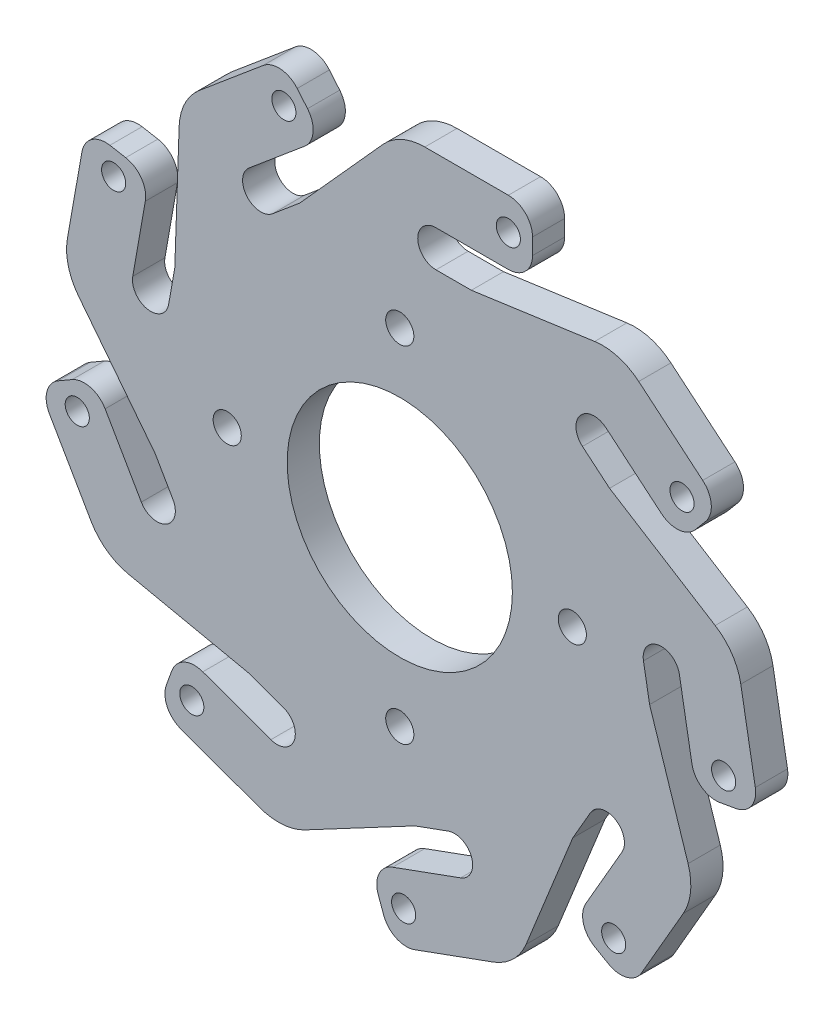
from build123d import *

# Parameters (mm, degrees)
SKETCH1_R          = 14
SKETCH1_R_2        = 1.75
SKETCH1_R_3        = 1.5
BASE_FLANGE1_DEPTH = 4


# Sheet-metal steps are written as plain solids
with BuildPart() as part:
    # Sketch1 → Base-Flange1 (new body)
    with BuildSketch(Plane.XY):
        with BuildLine():
            Line((-12.445814591, 28.677522558), (-2.085412981, 40.183914245))
            ThreePointArc((-2.085412981, 40.183914245), (0.269444296, 41.894818203), (3.116600797, 42.5))
            Line((3.116600797, 42.5), (13.5, 42.5))
            ThreePointArc((13.5, 42.5), (15.621320344, 41.621320344), (16.5, 39.5))
            Line((16.5, 39.5), (16.5, 37.5))
            ThreePointArc((16.5, 37.5), (15.621320344, 35.378679656), (13.5, 34.5))
            Line((13.5, 34.5), (4.5, 34.5))
            ThreePointArc((4.5, 34.5), (2.234136105, 32.234136105), (4.5, 29.96827221))
            Line((4.5, 29.96827221), (8.899509069, 29.96827221))
            Line((8.899509069, 29.96827221), (24.232203159, 32.123141835))
            ThreePointArc((24.232203159, 32.123141835), (27.135876357, 31.920097226), (29.705928134, 30.553576456))
            Line((29.705928134, 30.553576456), (37.660073394, 23.879256102))
            ThreePointArc((37.660073394, 23.879256102), (38.720294659, 21.842590001), (38.029843894, 19.652759943))
            Line((38.029843894, 19.652759943), (36.744268675, 18.120671057))
            ThreePointArc((36.744268675, 18.120671057), (34.707602574, 17.060449792), (32.517772516, 17.750900557))
            Line((32.517772516, 17.750900557), (25.623372528, 23.535989044))
            ThreePointArc((25.623372528, 23.535989044), (22.431150845, 23.256705835), (22.710434054, 20.064484152))
            Line((22.710434054, 20.064484152), (26.080653529, 17.236534234))
            Line((26.080653529, 17.236534234), (39.211302131, 9.031594352))
            ThreePointArc((39.211302131, 9.031594352), (41.305130289, 7.009608003), (42.395521552, 4.310794923))
            Line((42.395521552, 4.310794923), (44.198579902, -5.914857115))
            ThreePointArc((44.198579902, -5.914857115), (43.701612775, -8.156530957), (41.765101175, -9.390224907))
            Line((41.765101175, -9.390224907), (39.795485669, -9.737521262))
            ThreePointArc((39.795485669, -9.737521262), (37.553811827, -9.240554136), (36.320117877, -7.304042536))
            Line((36.320117877, -7.304042536), (34.757284278, 1.559227241))
            ThreePointArc((34.757284278, 1.559227241), (32.132380811, 3.397204436), (30.294403616, 0.772300968))
            Line((30.294403616, 0.772300968), (31.058370348, -3.560369672))
            Line((31.058370348, -3.560369672), (35.84299705, -18.285936503))
            ThreePointArc((35.84299705, -18.285936503), (36.147254703, -21.180754707), (35.247779262, -23.949055464))
            Line((35.247779262, -23.949055464), (30.056079661, -32.941342951))
            ThreePointArc((30.056079661, -32.941342951), (28.234460585, -34.33912043), (25.958003449, -34.039419162))
            Line((25.958003449, -34.039419162), (24.225952642, -33.039419162))
            ThreePointArc((24.225952642, -33.039419162), (22.828175163, -31.217800086), (23.127876431, -28.941342951))
            Line((23.127876431, -28.941342951), (27.627876431, -21.147114317))
            ThreePointArc((27.627876431, -21.147114317), (26.798512683, -18.051886675), (23.703285041, -18.881250422))
            Line((23.703285041, -18.881250422), (21.503530506, -22.69133704))
            Line((21.503530506, -22.69133704), (15.703355299, -37.047274443))
            ThreePointArc((15.703355299, -37.047274443), (14.07567691, -39.460406892), (11.60720932, -41.002876635))
            Line((11.60720932, -41.002876635), (1.850005711, -44.554208318))
            ThreePointArc((1.850005711, -44.554208318), (-0.443909504, -44.454053817), (-1.995132582, -42.761190886))
            Line((-1.995132582, -42.761190886), (-2.679172868, -40.881805644))
            ThreePointArc((-2.679172868, -40.881805644), (-2.579018367, -38.587890429), (-0.886155436, -37.036667352))
            Line((-0.886155436, -37.036667352), (7.571078151, -33.958486062))
            ThreePointArc((7.571078151, -33.958486062), (8.925322639, -31.054299386), (6.021135963, -29.700054898))
            Line((6.021135963, -29.700054898), (1.886949755, -31.20477562))
            Line((1.886949755, -31.20477562), (-11.78406092, -38.473780937))
            ThreePointArc((-11.78406092, -38.473780937), (-14.582066543, -39.276096138), (-17.464502862, -38.870996132))
            Line((-17.464502862, -38.870996132), (-27.221706472, -35.319664448))
            ThreePointArc((-27.221706472, -35.319664448), (-28.914569403, -33.768441371), (-29.014723904, -31.474526156))
            Line((-29.014723904, -31.474526156), (-28.330683618, -29.595140915))
            ThreePointArc((-28.330683618, -29.595140915), (-26.779460541, -27.902277983), (-24.485545325, -27.802123482))
            Line((-24.485545325, -27.802123482), (-16.028311738, -30.880304772))
            ThreePointArc((-16.028311738, -30.880304772), (-13.124125062, -29.526060284), (-14.47836955, -26.621873608))
            Line((-14.47836955, -26.621873608), (-18.612555757, -25.117152886))
            Line((-18.612555757, -25.117152886), (-33.757584069, -21.897977741))
            ThreePointArc((-33.757584069, -21.897977741), (-36.416698999, -20.714063497), (-38.364380059, -18.550944536))
            Line((-38.364380059, -18.550944536), (-43.556079661, -9.558657049))
            ThreePointArc((-43.556079661, -9.558657049), (-43.855780928, -7.282199914), (-42.458003449, -5.460580838))
            Line((-42.458003449, -5.460580838), (-40.725952642, -4.460580838))
            ThreePointArc((-40.725952642, -4.460580838), (-38.449495507, -4.16087957), (-36.627876431, -5.558657049))
            Line((-36.627876431, -5.558657049), (-32.127876431, -13.352885683))
            ThreePointArc((-32.127876431, -13.352885683), (-29.032648788, -14.18224943), (-28.203285041, -11.087021788))
            Line((-28.203285041, -11.087021788), (-30.403039576, -7.27693517))
            Line((-30.403039576, -7.27693517), (-39.935558458, 4.924132608))
            ThreePointArc((-39.935558458, 4.924132608), (-41.211553267, 7.540309666), (-41.313137454, 10.449300179))
            Line((-41.313137454, 10.449300179), (-39.510079105, 20.674952217))
            ThreePointArc((-39.510079105, 20.674952217), (-38.276385155, 22.611463816), (-36.034711312, 23.108430943))
            Line((-36.034711312, 23.108430943), (-34.065095806, 22.761134587))
            ThreePointArc((-34.065095806, 22.761134587), (-32.128584207, 21.527440637), (-31.63161708, 19.285766795))
            Line((-31.63161708, 19.285766795), (-33.194450679, 10.422497018))
            ThreePointArc((-33.194450679, 10.422497018), (-31.356473484, 7.797593551), (-28.731570017, 9.635570746))
            Line((-28.731570017, 9.635570746), (-27.967603284, 13.968241386))
            Line((-27.967603284, 13.968241386), (-27.427241211, 29.442186584))
            ThreePointArc((-27.427241211, 29.442186584), (-26.723063746, 32.266488135), (-24.93101869, 34.560201209))
            Line((-24.93101869, 34.560201209), (-16.97687343, 41.234521563))
            ThreePointArc((-16.97687343, 41.234521563), (-14.787043372, 41.924972328), (-12.750377271, 40.864751063))
            Line((-12.750377271, 40.864751063), (-11.464802052, 39.332662177))
            ThreePointArc((-11.464802052, 39.332662177), (-10.774351287, 37.142832119), (-11.834572552, 35.106166018))
            Line((-11.834572552, 35.106166018), (-18.72897254, 29.321077531))
            ThreePointArc((-18.72897254, 29.321077531), (-19.008255749, 26.128855848), (-15.816034066, 25.84957264))
            Line((-15.816034066, 25.84957264), (-12.445814591, 28.677522558))
        make_face()
        Circle(SKETCH1_R, mode=Mode.SUBTRACT)
        with Locations((0, 21.45)):
            Circle(SKETCH1_R_2, mode=Mode.SUBTRACT)
        with Locations((21.45, 0)):
            Circle(SKETCH1_R_2, mode=Mode.SUBTRACT)
        with Locations((0, -21.45)):
            Circle(SKETCH1_R_2, mode=Mode.SUBTRACT)
        with Locations((-21.45, 0)):
            Circle(SKETCH1_R_2, mode=Mode.SUBTRACT)
        with Locations((13.5, 38.5)):
            Circle(SKETCH1_R_3, mode=Mode.SUBTRACT)
        with Locations((35.088922955, 20.815078329)):
            Circle(SKETCH1_R_3, mode=Mode.SUBTRACT)
        with Locations((40.259348889, -6.609449825)):
            Circle(SKETCH1_R_3, mode=Mode.SUBTRACT)
        with Locations((26.591978046, -30.941342951)):
            Circle(SKETCH1_R_3, mode=Mode.SUBTRACT)
        with Locations((0.481925137, -40.795437835)):
            Circle(SKETCH1_R_3, mode=Mode.SUBTRACT)
        with Locations((-25.853625899, -31.560893965)):
            Circle(SKETCH1_R_3, mode=Mode.SUBTRACT)
        with Locations((-40.091978046, -7.558657049)):
            Circle(SKETCH1_R_3, mode=Mode.SUBTRACT)
        with Locations((-35.570848092, 19.980359506)):
            Circle(SKETCH1_R_3, mode=Mode.SUBTRACT)
        with Locations((-14.405722991, 38.170343791)):
            Circle(SKETCH1_R_3, mode=Mode.SUBTRACT)
    extrude(amount=-BASE_FLANGE1_DEPTH)


solid = part.part
